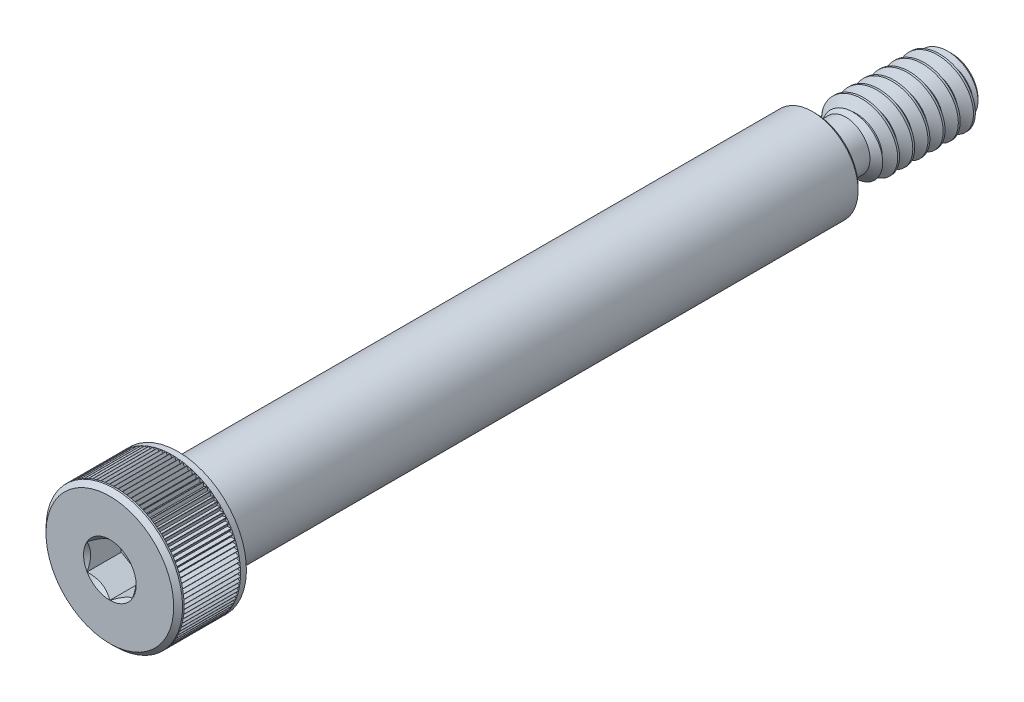
from build123d import *

# Parameters (mm, degrees)
CHAMFER1_SIZE      = 0.60325
CHAMFER2_SIZE      = 0.3095625
CHAMFER3_SIZE      = 0.2032
CUT_EXTRUDE5_DEPTH = 1.968103125
CIRPATTERN1_COUNT  = 99
CUT_EXTRUDE2_DEPTH = 2.38125
CUT_SWEEP1_PITCH   = 1.058333333


with BuildPart() as part:
    # Sketch1 → Revolve1 (revolve)
    with BuildSketch(Plane(origin=(0, 0, 0), x_dir=(0, 0, -1), z_dir=(1, 0, 0))):
        Polygon((0, 4.7625), (4.7625, 4.7625), (4.7625, 3.175), (49.2125, 3.175), (49.2125, 2.413), (58.7375, 2.413), (58.7375, 0), (0, 0), align=None)
    revolve(axis=Axis((0, 0, -58.7375), (0, 0, 1)))

    # Sketch5 → Cut-Revolve1 (revolve, cut)
    with BuildSketch(Plane(origin=(0, 0, 0), x_dir=(0, 0, -1), z_dir=(1, 0, 0))):
        with BuildLine():
            Line((49.2125, 3.175), (52.8066, 3.175))
            Line((52.8066, 3.175), (51.3207, 1.6891))
            Line((51.3207, 1.6891), (49.9364, 1.6891))
            ThreePointArc((49.9364, 1.6891), (49.424525401, 1.901125401), (49.2125, 2.413))
            Line((49.2125, 2.413), (49.2125, 3.175))
        make_face()
    revolve(axis=Axis((0, 0, -58.7375), (0, 0, 1)), mode=Mode.SUBTRACT)

    # Chamfer1
    chamfer1_edges = [part.edges().sort_by_distance(p)[0] for p in [
        (0, -2.413, -58.7375),
    ]]
    chamfer(chamfer1_edges, length=CHAMFER1_SIZE)

    # Chamfer2
    chamfer2_edges = [part.edges().sort_by_distance(p)[0] for p in [
        (0, -4.7625, 0),
    ]]
    chamfer(chamfer2_edges, length=CHAMFER2_SIZE)

    # Chamfer3
    chamfer3_edges = [part.edges().sort_by_distance(p)[0] for p in [
        (0, -3.175, -49.2125),
    ]]
    chamfer(chamfer3_edges, length=CHAMFER3_SIZE)

    # Sketch11 → Cut-Extrude5 (cut, symmetric)
    with BuildSketch(Plane.XY.offset(-2.38125)):
        Polygon((0, 4.51485), (0.142980794, 4.7625), (-0.142980794, 4.7625), align=None)
    cut_extrude5 = extrude(amount=CUT_EXTRUDE5_DEPTH, both=True, mode=Mode.SUBTRACT)

    # CirPattern1: Cut-Extrude5 ×99 about axis
    cirpattern1_axis = Axis((0, 0, 0), (0, 0, 1))
    for i in range(1, CIRPATTERN1_COUNT):
        add(cut_extrude5.rotate(cirpattern1_axis, i * 360 / CIRPATTERN1_COUNT), mode=Mode.SUBTRACT)

    # Sketch8 → Cut-Extrude2 (cut)
    with BuildSketch(Plane.XY):
        Polygon((1.5875, 0.916543552), (0, 1.833087105), (-1.5875, 0.916543552), (-1.5875, -0.916543552), (0, -1.833087105), (1.5875, -0.916543552), align=None)
    extrude(amount=-CUT_EXTRUDE2_DEPTH, mode=Mode.SUBTRACT)

    # Cut-Extrude4 cone 1 section (through the dimple's axis) → Cut-Extrude4 (revolve, cut)
    with BuildSketch(Plane(origin=(0, 0, 0), x_dir=(0, -1, 0), z_dir=(1, 0, 0))):
        Polygon((0, 0), (1.833087105, 0), (0, 1.833087105), align=None)
    revolve(axis=Axis((0, 0, 0), (0, 0, -1)), mode=Mode.SUBTRACT)

    # Cut-Sweep1: the profile of Sketch4 screwed along a right-hand helix of 10 turns, 8 arcs to a turn; built about Z, then put on its axis
    cut_sweep1_z = Axis((0, 0, 0), (0, 0, 1))
    cut_sweep1_corners = [(2.470283972, 0, 0.033072917), (2.470283972, 0, -0.959114583), (1.725592336, 0, -0.529166667), (1.725592336, 0, -0.396875)]
    with BuildLine(mode=Mode.PRIVATE) as cut_sweep1_profile:
        Line(cut_sweep1_corners[0], cut_sweep1_corners[1])
        Line(cut_sweep1_corners[1], cut_sweep1_corners[2])
        Line(cut_sweep1_corners[2], cut_sweep1_corners[3])
        Line(cut_sweep1_corners[3], cut_sweep1_corners[0])
    cut_sweep1_cap = Face(cut_sweep1_profile.wire())
    cut_sweep1_turn_angles = [0, 22.5, 45, 67.5, 90, 112.5, 135, 157.5, 180, 202.5, 225, 247.5, 270, 292.5, 315, 337.5, 360]
    cut_sweep1_turn_weights = [1, 0.9238795325112867, 1, 0.9238795325112867, 1, 0.9238795325112867, 1, 0.9238795325112867, 1, 0.9238795325112867, 1, 0.9238795325112867, 1, 0.9238795325112867, 1, 0.9238795325112867, 1]
    cut_sweep1_turn_rails = [Edge.make_bspline([Vector(p[0], p[1], 0).rotate(cut_sweep1_z, cut_sweep1_turn_angles[k]) / cut_sweep1_turn_weights[k] + Vector(0, 0, p[2] + CUT_SWEEP1_PITCH * cut_sweep1_turn_angles[k] / 360) for k in range(17)], [0, 0, 0, 1, 1, 2, 2, 3, 3, 4, 4, 5, 5, 6, 6, 7, 7, 8, 8, 8], 2, cut_sweep1_turn_weights) for p in cut_sweep1_corners]
    cut_sweep1_turn_sides = [Face.make_surface_from_curves(cut_sweep1_turn_rails[p[0]], cut_sweep1_turn_rails[p[1]]) for p in [(0, 1), (1, 2), (2, 3), (3, 0)]]
    cut_sweep1 = Plane(origin=(0, 0, -58.7375), x_dir=(0, 1, 0), z_dir=(0, 0, 1)) * Solid(Shell([*[p.moved(Location((0, 0, CUT_SWEEP1_PITCH * i))) for i in range(10) for p in cut_sweep1_turn_sides], cut_sweep1_cap, cut_sweep1_cap.rotate(cut_sweep1_z, 3600).moved(Location((0, 0, CUT_SWEEP1_PITCH * 3600 / 360)))]))
    add(cut_sweep1, mode=Mode.SUBTRACT)

    # Sketch12 → Revolve2 (revolve)
    with BuildSketch(Plane(origin=(0, 0, 0), x_dir=(0, 0, -1), z_dir=(1, 0, 0))):
        with BuildLine():
            Line((49.2125, 2.9718), (49.0093, 3.175))
            Line((49.0093, 3.175), (4.7625, 3.175))
            Line((4.7625, 3.175), (4.7625, 0))
            Line((4.7625, 0), (49.2125, 0))
            Line((49.2125, 0), (51.3207, 0))
            Line((51.3207, 0), (51.3207, 1.6891))
            Line((51.3207, 1.6891), (49.9364, 1.6891))
            ThreePointArc((49.9364, 1.6891), (49.424525401, 1.901125401), (49.2125, 2.413))
            Line((49.2125, 2.413), (49.2125, 2.9718))
        make_face()
    revolve(axis=Axis((0, 0, -4.7625), (0, 0, -1)))


solid = part.part
